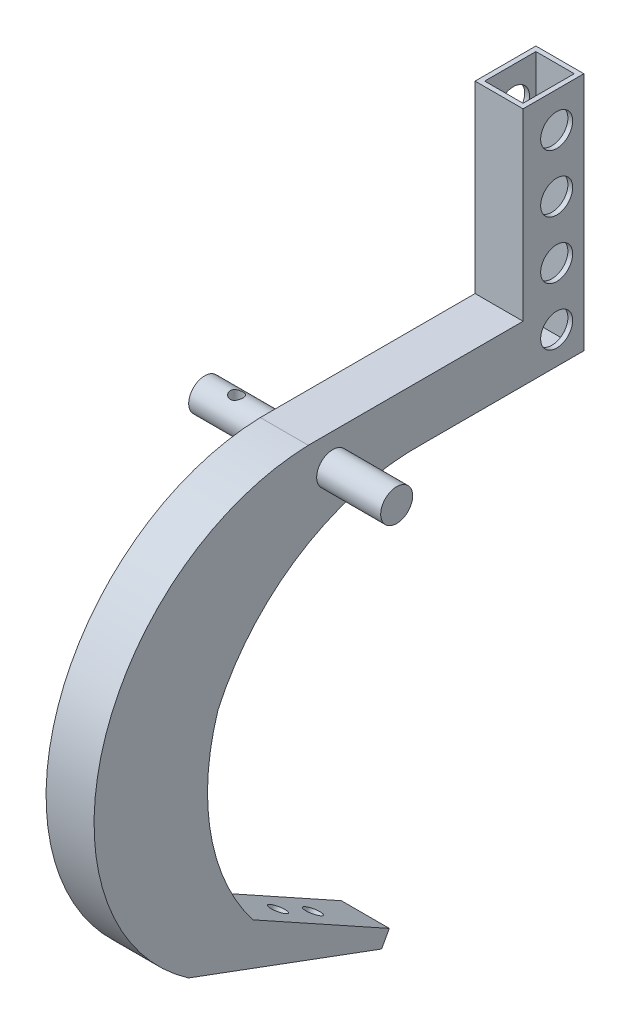
from build123d import *

# Parameters (mm, degrees)
BOSS_EXTRUDE1_DEPTH = 15
SHELL1_START        = -12
SHELL1_DEPTH        = 24
SKETCH3_R           = 10
CUT_EXTRUDE2_DEPTH  = 412.603799071
BOSS_EXTRUDE2_START = 40
SKETCH4_R           = 10
BOSS_EXTRUDE2_DEPTH = 120
LPATTERN1_COUNT     = 4
LPATTERN1_PITCH     = 36
SKETCH6_R           = 5
CUT_EXTRUDE3_DEPTH  = 416.623251767
CUT_EXTRUDE4_REACH  = 417.623
SKETCH7_R           = 4


# Read off the part's stored shape, not the designer's step: Shell1
with BuildPart() as part:
    # Sketch1 → Boss-Extrude1 (new, symmetric)
    with BuildSketch(Plane(origin=(0, 0, 0), x_dir=(0, 0, -1), z_dir=(1, 0, 0))):
        with BuildLine():
            Line((0, 0), (85.251371582, -47.255606917))
            Line((85.251371582, -47.255606917), (80.40327538, -56.001803988))
            Line((80.40327538, -56.001803988), (-40.245063676, -11.361449965))
            ThreePointArc((-40.245063676, -11.361449965), (-93.575565654, 141.17838747), (34.587469981, 239.599831994))
            Line((34.587469981, 239.599831994), (168.825159395, 239.599831994))
            Line((168.825159395, 239.599831994), (168.825159395, 354.599831994))
            Line((168.825159395, 354.599831994), (206.825159395, 354.599831994))
            Line((206.825159395, 354.599831994), (206.825159395, 204.599831994))
            Line((206.825159395, 204.599831994), (106.825159395, 204.599831994))
            ThreePointArc((106.825159395, 204.599831994), (30.408436566, 184.017865838), (-21.845490063, 124.581611838))
            ThreePointArc((-21.845490063, 124.581611838), (-26.384125187, 59.579639949), (0, 0))
        make_face()
    extrude(amount=BOSS_EXTRUDE1_DEPTH, both=True)

    # Shell1 outline → Shell1 (cut)
    with BuildSketch(Plane.YZ.offset(SHELL1_START)):
        with BuildLine():
            ThreePointArc((125.505371341, 24.69972698), (125.667778254, 24.641959892), (125.826599381, 24.574960703))
            ThreePointArc((125.826599381, 24.574960703), (186.553407601, -28.804836135), (207.599831994, -106.870164943))
            Line((207.599831994, -106.870164943), (207.599831994, -203.825159395))
            Line((207.599831994, -203.825159395), (354.599831994, -203.825159395))
            Line((354.599831994, -203.825159395), (354.599831994, -171.825159395))
            Line((354.599831994, -171.825159395), (236.599831994, -171.825159395))
            Line((236.599831994, -171.825159395), (236.599831994, -34.630851514))
            ThreePointArc((236.599831994, -34.630851514), (140.483066901, 90.652257864), (-8.681515002, 38.842823077))
            Line((-8.681515002, 38.842823077), (-52.294295287, -79.028318808))
            Line((-52.294295287, -79.028318808), (-48.425037178, -81.1730836))
            Line((-48.425037178, -81.1730836), (-2.327347545, 1.989349905))
            ThreePointArc((-2.327347545, 1.989349905), (58.757023973, 29.285300463), (125.505371341, 24.69972698))
        make_face()
    extrude(amount=SHELL1_DEPTH, mode=Mode.SUBTRACT)

    # Sketch3 → Cut-Extrude2 (cut, through all)
    with BuildSketch(Plane(origin=(15, 0, 0), x_dir=(0, 0, -1), z_dir=(1, 0, 0))):
        with Locations((189.825159395, 224.599831994)):
            Circle(SKETCH3_R)
    cut_extrude2 = extrude(amount=-CUT_EXTRUDE2_DEPTH, mode=Mode.SUBTRACT)

    # Sketch4 → Boss-Extrude2 (add)
    with BuildSketch(Plane(origin=(15, 0, 0), x_dir=(0, 0, -1), z_dir=(1, 0, 0)).offset(BOSS_EXTRUDE2_START)):
        with Locations((49.825159395, 219.599831994)):
            Circle(SKETCH4_R)
    extrude(amount=-BOSS_EXTRUDE2_DEPTH)

    # LPattern1: Cut-Extrude2 ×4
    with Locations(*[(0, i * LPATTERN1_PITCH, 0) for i in range(1, LPATTERN1_COUNT)]):
        add(cut_extrude2, mode=Mode.SUBTRACT)

    # Sketch6 → Cut-Extrude3 (cut, through all)
    with BuildSketch(Plane(origin=(0, 0, 0), x_dir=(1, 0, 0), z_dir=(0, 0.8746197071393954, -0.48480962024633795))):
        with Locations(Location((0, 35, 0), (0, 0, 270))):
            Circle(SKETCH6_R)
        with Locations(Location((0, 60, 0), (0, 0, 270))):
            Circle(SKETCH6_R)
    extrude(amount=-CUT_EXTRUDE3_DEPTH, mode=Mode.SUBTRACT)

    # Sketch7 → Cut-Extrude4 (cut, up to next)
    with BuildSketch(Plane(origin=(0, 0, 0), x_dir=(1, 0, 0), z_dir=(0, 1, 0)), mode=Mode.PRIVATE) as cut_extrude4_sk1:
        with Locations(Location((-45, 49.825159395, 0), (0, 0, 90))):
            Circle(SKETCH7_R)
    cut_extrude4_tool1 = extrude(cut_extrude4_sk1.sketch, amount=CUT_EXTRUDE4_REACH, mode=Mode.PRIVATE) & part.part
    add(cut_extrude4_tool1.solids().sort_by_distance((-45, 0, -49.825159))[0], mode=Mode.SUBTRACT)


solid = part.part
